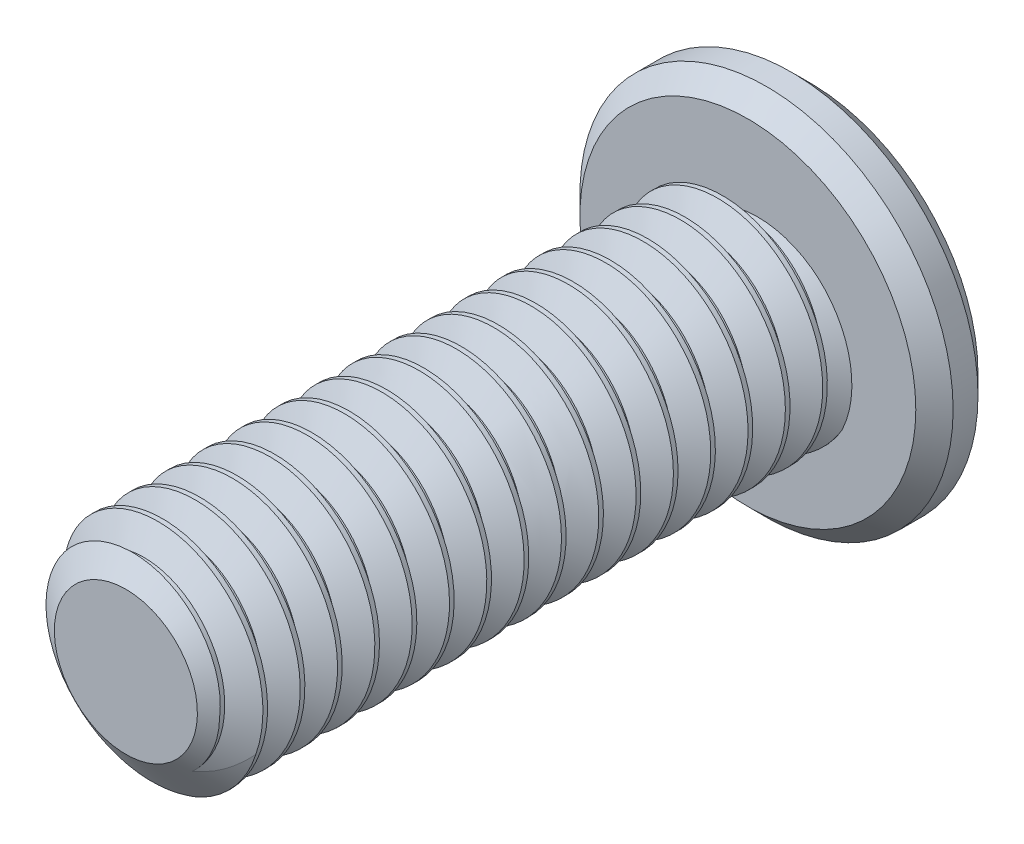
from build123d import *

# Parameters (mm, degrees)
SKETCH1_R          = 1.75
EXTRUDE1_DEPTH     = 11
SKETCH6_R          = 3
EXTRUDE2_DEPTH     = 1
CUT_EXTRUDE1_DEPTH = 0.75
SKETCH8_R          = 0.577350269
CUT_EXTRUDE2_DEPTH = 0.75
CUT_EXTRUDE2_TAPER = 45
CHAMFER1_SIZE      = 0.3
CUT_SWEEP1_PITCH   = 0.6
CUT_SWEEP1_TO      = 10


with BuildPart() as part:
    # Sketch1 → Extrude1 (new body)
    with BuildSketch(Plane.XY):
        Circle(SKETCH1_R)
    extrude(amount=EXTRUDE1_DEPTH)

    # Sketch4 → Cut-Revolve1 (revolve, cut)
    with BuildSketch(Plane(origin=(0, 0, 0), x_dir=(0, 0, -1), z_dir=(1, 0, 0))):
        Polygon((-10.579875477, 1.75), (-11, 1.15), (-11, 1.75), align=None)
    revolve(axis=Axis((0, 0, 0), (0, 0, 1)), mode=Mode.SUBTRACT)

    # Sketch6 → Extrude2 (add)
    with BuildSketch(Plane.XY):
        Circle(SKETCH6_R)
    extrude(amount=EXTRUDE2_DEPTH)

    # Sketch7 → Cut-Extrude1 (cut)
    with BuildSketch(Plane.XY):
        Polygon((0, 0.577350269), (-0.5, 0.288675135), (-0.5, -0.288675135), (0, -0.577350269), (0.5, -0.288675135), (0.5, 0.288675135), align=None)
    extrude(amount=CUT_EXTRUDE1_DEPTH, mode=Mode.SUBTRACT)

    # Sketch8 → Cut-Extrude2 (cut)
    with BuildSketch(Plane.XY):
        Circle(SKETCH8_R)
    extrude(amount=CUT_EXTRUDE2_DEPTH, taper=CUT_EXTRUDE2_TAPER, mode=Mode.SUBTRACT)

    # Chamfer1
    chamfer1_edges = [part.edges().sort_by_distance(p)[0] for p in [
        (-3, 0, 1),
        (-3, 0, 0),
    ]]
    chamfer(chamfer1_edges, length=CHAMFER1_SIZE)


with BuildPart() as body_2:
    # Split1: read off the stored shape, not the designer's step
    # Split1: the piece on the far side of the plane
    add(part.part)
    split(bisect_by=Plane.XY.offset(1), keep=Keep.BOTTOM)


with BuildPart() as part_1:
    add(part.part)

    # Split1
    split(bisect_by=Plane.XY.offset(1), keep=Keep.TOP)

    # Cut-Sweep1: arcs per turn and ends read off the stored shape
    # Cut-Sweep1: the profile of Sketch3 profile screwed along a left-hand helix through 18 turns, 6 arcs to a turn; built about Z, then put on its axis
    cut_sweep1_z = Axis((0, 0, 0), (0, 0, 1))
    cut_sweep1_corners = [(1.7503, 0, -0.525173205), (1.360288568, 0, -0.3), (1.360288568, 0, -0.225), (1.7503, 0, 0.000173205)]
    with BuildLine(mode=Mode.PRIVATE) as cut_sweep1_profile:
        Line(cut_sweep1_corners[0], cut_sweep1_corners[1])
        Line(cut_sweep1_corners[1], cut_sweep1_corners[2])
        Line(cut_sweep1_corners[2], cut_sweep1_corners[3])
        Line(cut_sweep1_corners[3], cut_sweep1_corners[0])
    cut_sweep1_cap = Face(cut_sweep1_profile.wire())
    cut_sweep1_turn_angles = [0, -30, -60, -90, -120, -150, -180, -210, -240, -270, -300, -330, -360]
    cut_sweep1_turn_weights = [1, 0.8660254037844387, 1, 0.8660254037844387, 1, 0.8660254037844387, 1, 0.8660254037844387, 1, 0.8660254037844387, 1, 0.8660254037844387, 1]
    cut_sweep1_turn_rails = [Edge.make_bspline([Vector(p[0], p[1], 0).rotate(cut_sweep1_z, cut_sweep1_turn_angles[k]) / cut_sweep1_turn_weights[k] + Vector(0, 0, p[2] + -CUT_SWEEP1_PITCH * cut_sweep1_turn_angles[k] / 360) for k in range(13)], [0, 0, 0, 1, 1, 2, 2, 3, 3, 4, 4, 5, 5, 6, 6, 6], 2, cut_sweep1_turn_weights) for p in cut_sweep1_corners]
    cut_sweep1_turn_sides = [Face.make_surface_from_curves(cut_sweep1_turn_rails[p[0]], cut_sweep1_turn_rails[p[1]]) for p in [(0, 1), (1, 2), (2, 3), (3, 0)]]
    cut_sweep1 = Plane(origin=(0, 0, 11), x_dir=(0, 1, 0), z_dir=(0, 0, -1)) * split(Solid(Shell([*[p.moved(Location((0, 0, CUT_SWEEP1_PITCH * i))) for i in range(18) for p in cut_sweep1_turn_sides], cut_sweep1_cap, cut_sweep1_cap.rotate(cut_sweep1_z, -6480).moved(Location((0, 0, -CUT_SWEEP1_PITCH * -6480 / 360)))])), bisect_by=Plane.XY.offset(CUT_SWEEP1_TO), keep=Keep.BOTTOM, mode=Mode.PRIVATE)
    add(cut_sweep1, mode=Mode.SUBTRACT)

    # Combine1: union body 2
    add(body_2.part)


solid = part_1.part
